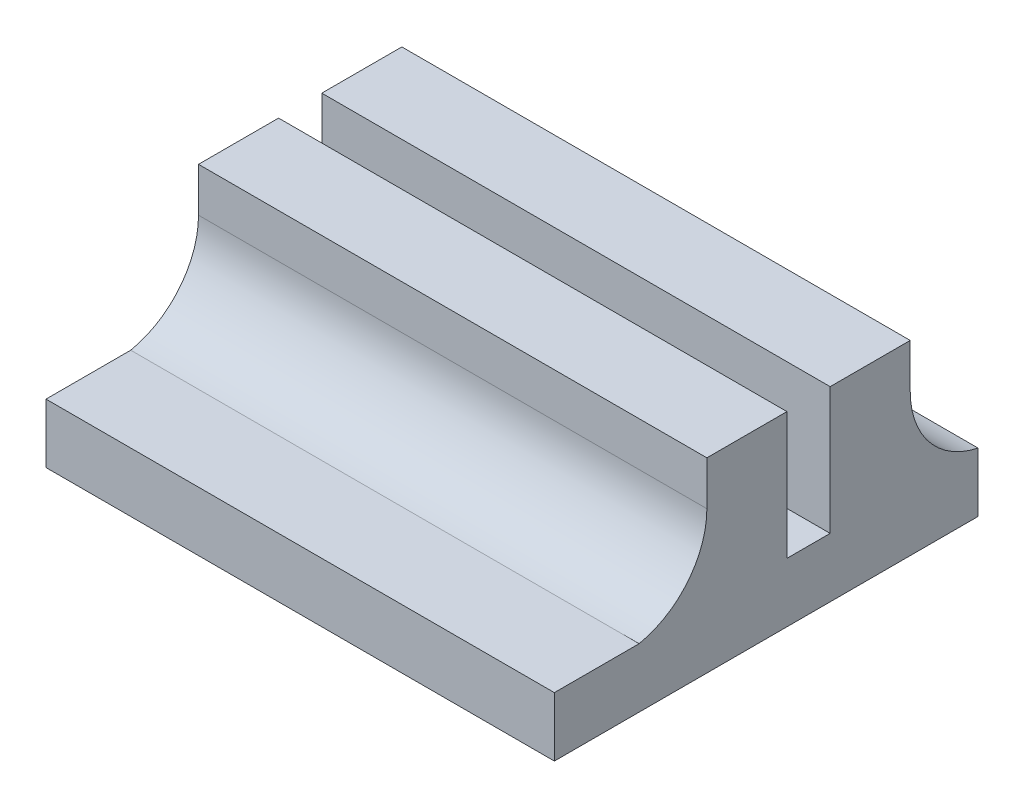
from build123d import *

# Parameters (mm, degrees)
SKETCH1_W           = 60
SKETCH1_H           = 40
BOSS_EXTRUDE1_DEPTH = 22
SKETCH2_W           = 60
SKETCH2_H           = 5.1
SKETCH2_H_2         = 8
CUT_EXTRUDE1_DEPTH  = 15
FILLET1_R           = 10
SKETCH3_W           = 60
SKETCH3_H           = 7
BOSS_EXTRUDE2_DEPTH = 10


with BuildPart() as part:
    # Sketch1 → Boss-Extrude1 (new body)
    with BuildSketch(Plane(origin=(0, 0, 0), x_dir=(1, 0, 0), z_dir=(0, 1, 0))):
        Rectangle(SKETCH1_W, SKETCH1_H)
    extrude(amount=BOSS_EXTRUDE1_DEPTH)

    # Sketch2 → Cut-Extrude1 (cut)
    with BuildSketch(Plane(origin=(0, 22, 0), x_dir=(1, 0, 0), z_dir=(0, 1, 0))):
        Rectangle(SKETCH2_W, SKETCH2_H)
        with Locations((0, 16)):
            Rectangle(SKETCH2_W, SKETCH2_H_2)
        with Locations((0, -16)):
            Rectangle(SKETCH2_W, SKETCH2_H_2)
    extrude(amount=-CUT_EXTRUDE1_DEPTH, mode=Mode.SUBTRACT)

    # Fillet1
    # the kernel refuses this fillet: 10 mm, written as the material it adds along each edge
    with BuildSketch(Plane(origin=(-30, 7, 12), x_dir=(0, 0, 1), z_dir=(1, 0, 0)), Plane(origin=(30, 7, -12), x_dir=(0, 0, -1), z_dir=(-1, 0, 0))) as fillet1_piece_1:
        with BuildLine():
            CenterArc((10, -9.797958971), FILLET1_R, 101.536959033, 78.463040967)
            Line((0, -9.797958971), (-0.2, -9.797958971))
            Line((-0.2, -9.797958971), (-0.2, 0))
            Line((-0.2, 0), (0, 0.2))
            ThreePointArc((0, 0.2), (4, 0.2), (7.96, 0.195959179))
            Line((7.96, 0.195959179), (8, 0))
        make_face()
    extrude(amount=60)

    # Sketch3 → Boss-Extrude2 (add)
    with BuildSketch(Plane.XY.offset(20)):
        with Locations((0, 3.5)):
            Rectangle(SKETCH3_W, SKETCH3_H)
    extrude(amount=BOSS_EXTRUDE2_DEPTH)


solid = part.part
